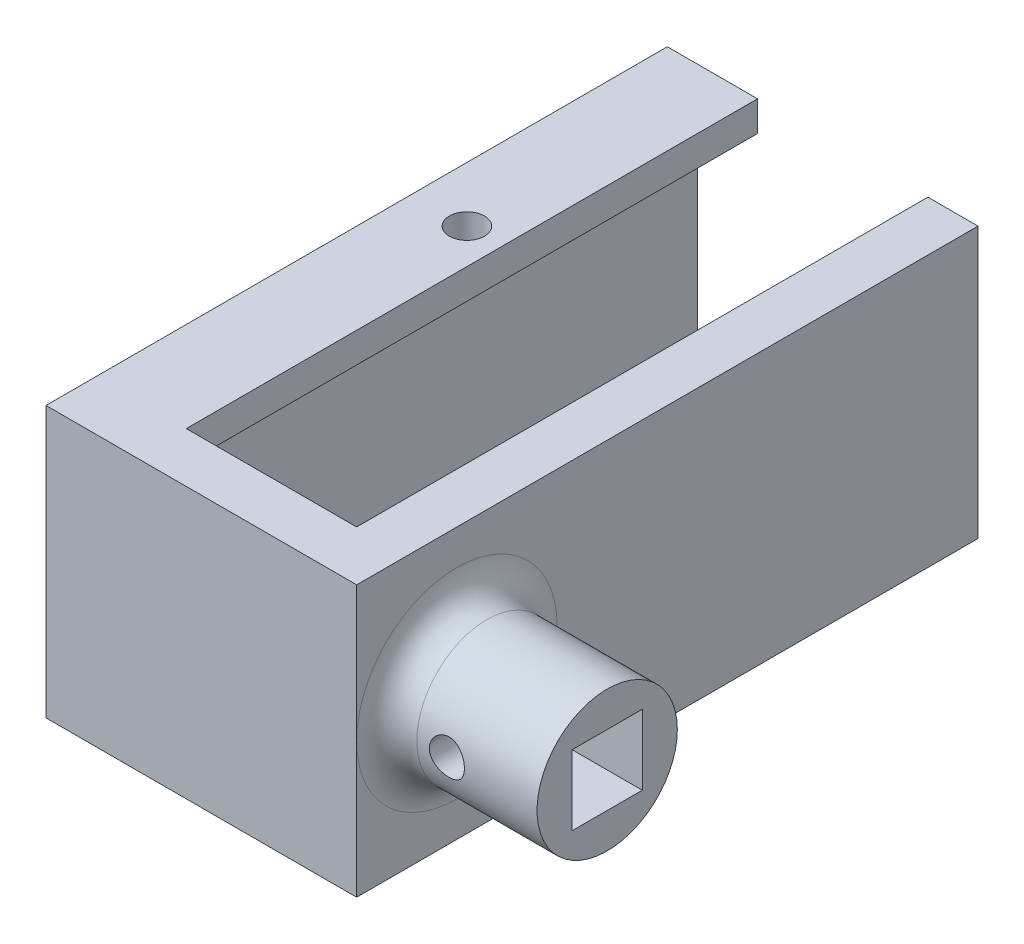
from build123d import *

# Parameters (mm, degrees)
BOSS_EXTRU_1_DEPTH           = 3
BOSS_EXTRU_2_DEPTH           = 6
BOSS_EXTRU_3_DEPTH           = 28
BOSS_EXTRU_4_START           = 23
BOSS_EXTRU_4_DEPTH           = 5
ESQUISSE3_W                  = 21.000000000000014
ESQUISSE3_H                  = 5
BOSS_EXTRU_5_DEPTH           = 28
BOSS_EXTRU_6_DEPTH           = 57
ESQUISSE5_R                  = 6.9999999999999964
BOSS_EXTRU_7_DEPTH           = 15
CONG_1_R                     = 3
ENL_V_MAT_EXTRU_1_DEPTH      = 62.69278726074873
ESQUISSE8_R                  = 1.7499999999999998
ENL_V_MAT_EXTRU_2_DEPTH      = 62.69278726074873
ESQUISSE9_R                  = 3.0000000000000013
ENL_V_MAT_EXTRU_5_DEPTH      = 1.5
ENL_V_MAT_EXTRU_6_DEPTH      = 69.19457456425694
ENL_V_MAT_EXTRU_6_DEPTH_BACK = 69.19457456425694
ESQUISSE10_R                 = 1.7500000000000036


with BuildPart() as part:
    # Esquisse1 → Boss.-Extru.1 (new body)
    with BuildSketch(Plane.YZ):
        Polygon((-13.500000000000007, 30.999999999999996), (13.499999999999993, 30.999999999999996), (13.500000000000004, -31.000000000000004), (-13.499999999999998, -31.000000000000004), align=None)
    extrude(amount=BOSS_EXTRU_1_DEPTH)

    # Esquisse2 → Boss.-Extru.2 (add)
    with BuildSketch(Plane.YZ.offset(3)):
        Polygon((-10.500000000000005, 25.999999999999996), (-13.500000000000007, 25.999999999999996), (-13.499999999999998, -26.000000000000004), (-10.499999999999998, -26.000000000000004), align=None)
    boss_extru_2 = extrude(amount=BOSS_EXTRU_2_DEPTH)

    # Esquisse2<3> → Boss.-Extru.3 (add)
    with BuildSketch(Plane.YZ.offset(3)):
        Polygon((-10.500000000000007, 30.999999999999996), (-13.500000000000007, 30.999999999999996), (-13.500000000000007, 25.999999999999996), (-10.500000000000005, 25.999999999999996), align=None)
        Polygon((-10.499999999999998, -26.000000000000004), (-13.500000000000005, -26.000000000000004), (-13.499999999999998, -31.000000000000004), (-10.499999999999998, -31.000000000000004), align=None)
    boss_extru_3 = extrude(amount=BOSS_EXTRU_3_DEPTH)

    # Esquisse2<4> → Boss.-Extru.4 (add)
    with BuildSketch(Plane.YZ.offset(3).offset(BOSS_EXTRU_4_START)):
        Polygon((-10.500000000000005, 25.999999999999996), (-13.500000000000007, 25.999999999999996), (-13.499999999999998, -26.000000000000004), (-10.499999999999998, -26.000000000000004), align=None)
    boss_extru_4 = extrude(amount=BOSS_EXTRU_4_DEPTH)

    # Symétrie1: Boss.-Extru.2, Boss.-Extru.3, Boss.-Extru.4 across plane
    add(boss_extru_2.mirror(Plane.ZX))
    add(boss_extru_3.mirror(Plane.ZX))
    add(boss_extru_4.mirror(Plane.ZX))

    # Esquisse3 → Boss.-Extru.5 (add)
    with BuildSketch(Plane.YZ.offset(3)):
        with Locations((0, 28.499999999999996)):
            Rectangle(ESQUISSE3_W, ESQUISSE3_H)
    extrude(amount=BOSS_EXTRU_5_DEPTH)

    # Esquisse4 → Boss.-Extru.6 (add)
    with BuildSketch(Plane(origin=(0, 0, 25.999999999999996), x_dir=(-1, 0, 0), z_dir=(0, 0, -1))):
        Polygon((-31, 10.500000000000005), (-30.999999999999996, -10.500000000000007), (-25.999999999999996, -10.500000000000002), (-26, 10.500000000000007), align=None)
    extrude(amount=BOSS_EXTRU_6_DEPTH)

    # Esquisse5 → Boss.-Extru.7 (add)
    with BuildSketch(Plane.YZ.offset(31)):
        with Locations((0, 20.999999999999996)):
            Circle(ESQUISSE5_R)
        Polygon((-3.5000000000000004, 24.499999999999996), (3.4999999999999996, 24.499999999999996), (3.5000000000000004, 17.499999999999996), (-3.4999999999999996, 17.499999999999996), align=None, mode=Mode.SUBTRACT)
    extrude(amount=BOSS_EXTRU_7_DEPTH)

    # Congé1
    cong_1_edges = [part.edges().sort_by_distance(p)[0] for p in [
        (31, -6.9999999999999964, 20.999999999999996),
    ]]
    fillet(cong_1_edges, radius=CONG_1_R)

    # Esquisse7 → Enlèv. mat.-Extru.1 (cut, through all)
    with BuildSketch(Plane(origin=(0, 13.499999999999998, 2.27e-15), x_dir=(1, 0, 0), z_dir=(0, 1, 1.7e-16))):
        Polygon((26, 26.000000000000007), (9.000000000000002, 26.000000000000004), (9.000000000000002, 31.000000000000007), (26, 31.000000000000007), align=None)
    extrude(amount=-ENL_V_MAT_EXTRU_1_DEPTH, mode=Mode.SUBTRACT)

    # Esquisse8 → Enlèv. mat.-Extru.2 (cut, through all)
    with BuildSketch(Plane.XZ.offset(13.500000000000004)):
        with Locations((5.5, -5.499999999999998)):
            Circle(ESQUISSE8_R)
    extrude(amount=-ENL_V_MAT_EXTRU_2_DEPTH, mode=Mode.SUBTRACT)

    # Esquisse9 → Enlèv. mat.-Extru.5 (cut)
    with BuildSketch(Plane.XZ.offset(13.500000000000004)):
        with Locations((5.5, -5.499999999999998)):
            Circle(ESQUISSE9_R)
    extrude(amount=-ENL_V_MAT_EXTRU_5_DEPTH, mode=Mode.SUBTRACT)

    # Esquisse10 → Enlèv. mat.-Extru.6 (cut, two sides: drawn at the far end of the back side and taken through both)
    with BuildSketch(Plane.XY.offset(17.499999999999996).offset(-ENL_V_MAT_EXTRU_6_DEPTH_BACK)):
        with Locations((37, -6.94e-15)):
            Circle(ESQUISSE10_R)
    extrude(amount=ENL_V_MAT_EXTRU_6_DEPTH + ENL_V_MAT_EXTRU_6_DEPTH_BACK, mode=Mode.SUBTRACT)


solid = part.part
